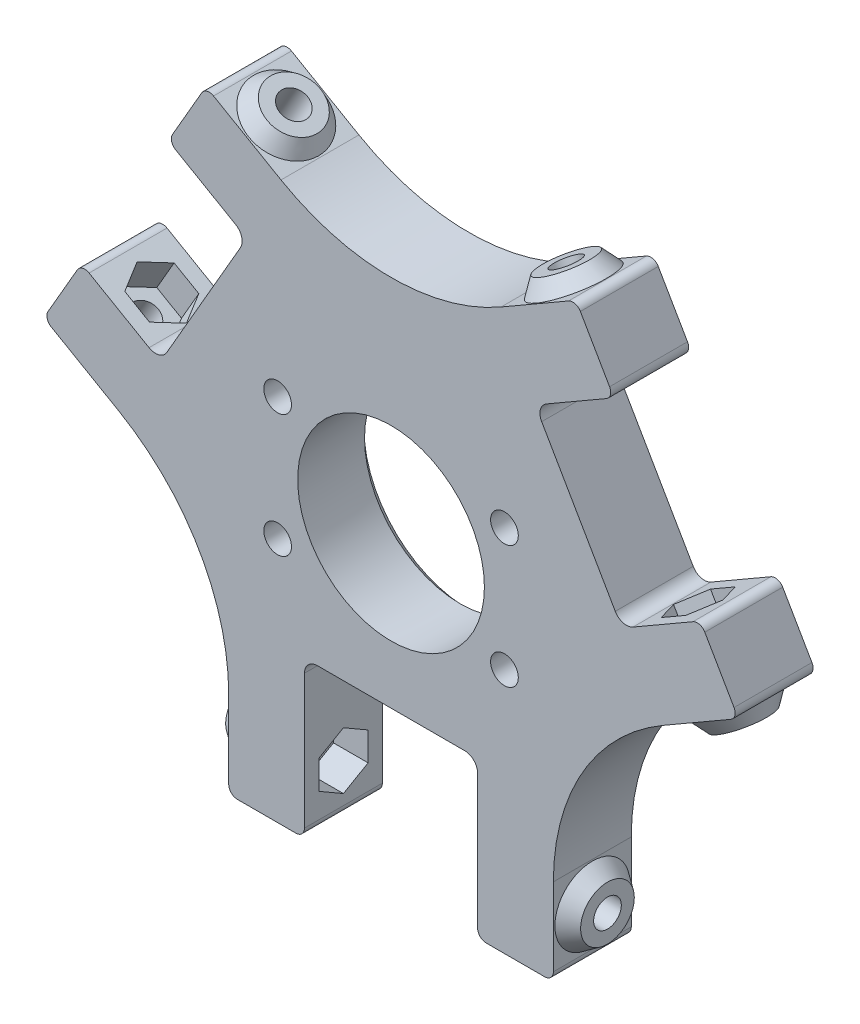
from build123d import *

# Parameters (mm, degrees)
BOSS_EXTRUDE1_DEPTH     = 9
SKETCH4_R               = 3.1
BOSS_EXTRUDE3_DEPTH     = 1.75
BOSS_EXTRUDE3_DRAFT     = 35
SKETCH7_R               = 1.600000259
CUT_EXTRUDE4_DEPTH      = 15
CUT_EXTRUDE5_DEPTH      = 7
MIRROR1_START           = -14
MIRROR1_DEPTH           = 4
MIRROR1_START_2         = -18.75
MIRROR1_2_OUTLINE_R     = 1.600000259
MIRROR1_2_DEPTH         = 4.75
CIRPATTERN1_START       = -14
CIRPATTERN1_DEPTH       = 28
CIRPATTERN1_START_2     = -18.75
CIRPATTERN1_2_OUTLINE_R = 1.600000259
CIRPATTERN1_2_DEPTH     = 37.5
CIRPATTERN1_START_3     = -20.405762011
CIRPATTERN1_3_OUTLINE_R = 1.600000259
CIRPATTERN1_3_DEPTH     = 1.655762011
CIRPATTERN1_4_DEPTH     = 28
CIRPATTERN1_5_OUTLINE_R = 1.600000259
CIRPATTERN1_5_DEPTH     = 37.5
CIRPATTERN1_START_4     = 18.75
CIRPATTERN1_6_OUTLINE_R = 1.600000259
CIRPATTERN1_6_DEPTH     = 1.616403084
SKETCH8_R               = 11.1
CUT_EXTRUDE6_DEPTH      = 55.051282913
CUT_EXTRUDE6_TAPER      = 2
SKETCH9_R               = 1.6
CUT_EXTRUDE8_DEPTH      = 55.051282913
CHAMFER1_SIZE           = 1.036815955
CHAMFER1_SIZE_2         = 1


with BuildPart() as part:
    # Sketch3 → Boss-Extrude1 (new body)
    with BuildSketch(Plane.XY):
        with BuildLine():
            Line((-18.75, -34.5), (-18.75, -25.5))
            ThreePointArc((-18.75, -25.5), (-22.155271914, -12.791352203), (-31.458647797, -3.487976321))
            Line((-31.458647797, -3.487976321), (-39.252876431, 1.012023679))
            ThreePointArc((-39.252876431, 1.012023679), (-39.718802257, 1.619230038), (-39.618901834, 2.378049083))
            Line((-39.618901834, 2.378049083), (-36.243901834, 8.223720558))
            ThreePointArc((-36.243901834, 8.223720558), (-35.636695476, 8.689646385), (-34.877876431, 8.589745962))
            Line((-34.877876431, 8.589745962), (-27.9496732, 4.589745962))
            ThreePointArc((-27.9496732, 4.589745962), (-26.811444633, 4.439895328), (-25.900635095, 5.138784068))
            Line((-25.900635095, 5.138784068), (-17.400635095, 19.861215932))
            ThreePointArc((-17.400635095, 19.861215932), (-17.250784461, 20.9994445), (-17.9496732, 21.910254038))
            Line((-17.9496732, 21.910254038), (-24.877876431, 25.910254038))
            ThreePointArc((-24.877876431, 25.910254038), (-25.343802257, 26.517460397), (-25.243901834, 27.276279442))
            Line((-25.243901834, 27.276279442), (-21.868901834, 33.121950917))
            ThreePointArc((-21.868901834, 33.121950917), (-21.261695476, 33.587876743), (-20.502876431, 33.487976321))
            Line((-20.502876431, 33.487976321), (-12.708647797, 28.987976321))
            ThreePointArc((-12.708647797, 28.987976321), (0, 25.582704407), (12.708647797, 28.987976321))
            Line((12.708647797, 28.987976321), (20.502876431, 33.487976321))
            ThreePointArc((20.502876431, 33.487976321), (21.261695476, 33.587876743), (21.868901834, 33.121950917))
            Line((21.868901834, 33.121950917), (25.243901834, 27.276279442))
            ThreePointArc((25.243901834, 27.276279442), (25.343802257, 26.517460397), (24.877876431, 25.910254038))
            Line((24.877876431, 25.910254038), (17.9496732, 21.910254038))
            ThreePointArc((17.9496732, 21.910254038), (17.250784461, 20.9994445), (17.400635095, 19.861215932))
            Line((17.400635095, 19.861215932), (25.900635095, 5.138784068))
            ThreePointArc((25.900635095, 5.138784068), (26.811444633, 4.439895328), (27.9496732, 4.589745962))
            Line((27.9496732, 4.589745962), (34.877876431, 8.589745962))
            ThreePointArc((34.877876431, 8.589745962), (35.636695476, 8.689646385), (36.243901834, 8.223720558))
            Line((36.243901834, 8.223720558), (39.618901834, 2.378049083))
            ThreePointArc((39.618901834, 2.378049083), (39.718802257, 1.619230038), (39.252876431, 1.012023679))
            Line((39.252876431, 1.012023679), (31.458647797, -3.487976321))
            ThreePointArc((31.458647797, -3.487976321), (22.155271914, -12.791352203), (18.75, -25.5))
            Line((18.75, -25.5), (18.75, -34.5))
            ThreePointArc((18.75, -34.5), (18.457106781, -35.207106781), (17.75, -35.5))
            Line((17.75, -35.5), (11, -35.5))
            ThreePointArc((11, -35.5), (10.292893219, -35.207106781), (10, -34.5))
            Line((10, -34.5), (10, -19))
            ThreePointArc((10, -19), (9.560660172, -17.939339828), (8.5, -17.5))
            Line((8.5, -17.5), (-8.5, -17.5))
            ThreePointArc((-8.5, -17.5), (-9.560660172, -17.939339828), (-10, -19))
            Line((-10, -19), (-10, -34.5))
            ThreePointArc((-10, -34.5), (-10.292893219, -35.207106781), (-11, -35.5))
            Line((-11, -35.5), (-17.75, -35.5))
            ThreePointArc((-17.75, -35.5), (-18.457106781, -35.207106781), (-18.75, -34.5))
        make_face()
    extrude(amount=BOSS_EXTRUDE1_DEPTH)


with BuildPart() as boss_extrude3_tool:
    # Sketch4 → Boss-Extrude3 (with draft: the straight prism first)
    with BuildSketch(Plane(origin=(20.5, 0, 0), x_dir=(0, 0, -1), z_dir=(1, 0, 0))):
        with Locations((-4.5, -30)):
            Circle(SKETCH4_R)
    extrude(amount=-BOSS_EXTRUDE3_DEPTH)
    # Boss-Extrude3: the draft: its side faces are tilted about the plane it starts from
    boss_extrude3_sides = [boss_extrude3_tool.faces().sort_by_distance(p)[0] for p in [
        (19.625, -30, 7.6),
    ]]
    draft(boss_extrude3_sides, Plane(origin=(20.5, 0, 0), x_dir=(0, 0, -1), z_dir=(1, 0, 0)), BOSS_EXTRUDE3_DRAFT)


with BuildPart() as part_1:
    add(part.part)

    # Boss-Extrude3: add boss_extrude3_tool
    add(boss_extrude3_tool.part)

    # Sketch7 → Cut-Extrude4 (cut)
    with BuildSketch(Plane(origin=(20.5, 0, 0), x_dir=(0, 0, -1), z_dir=(1, 0, 0))):
        with Locations((-4.5, -30)):
            Circle(SKETCH7_R)
    extrude(amount=-CUT_EXTRUDE4_DEPTH, mode=Mode.SUBTRACT)

    # Sketch5 → Cut-Extrude5 (cut)
    with BuildSketch(Plane(origin=(14, 0, 0), x_dir=(0, 0, -1), z_dir=(1, 0, 0))):
        Polygon((-7.349999794, -28.354551852), (-7.349999794, -31.645448148), (-4.5, -33.290896297), (-1.650000206, -31.645448148), (-1.650000206, -28.354551852), (-4.5, -26.709103703), align=None)
    extrude(amount=-CUT_EXTRUDE5_DEPTH, mode=Mode.SUBTRACT)

    # Mirror1: read off the stored shape, not the designer's step
    # Mirror1 outline → Mirror1 (cut)
    with BuildSketch(Plane.YZ.offset(MIRROR1_START)):
        Polygon((-26.709103703, 4.5), (-28.354551852, 7.349999794), (-31.645448148, 7.349999794), (-33.290896297, 4.5), (-31.645448148, 1.650000206), (-28.354551852, 1.650000206), align=None)
    extrude(amount=MIRROR1_DEPTH, mode=Mode.SUBTRACT)

    # Mirror1 2 outline → Mirror1 2 (cut)
    with BuildSketch(Plane.YZ.offset(MIRROR1_START_2)):
        with Locations((-30, 4.5)):
            Circle(MIRROR1_2_OUTLINE_R)
    extrude(amount=MIRROR1_2_DEPTH, mode=Mode.SUBTRACT)

    # Mirror1 3 outline → Mirror1 3 (revolve)
    with BuildSketch(Plane(origin=(0, -30, 4.5), x_dir=(0, 1, 0), z_dir=(0, 0, -1))):
        Polygon((1.600000259, -18.75), (1.600000259, -20.5), (3.1, -20.5), (4.325363192, -18.75), align=None)
    revolve(axis=Axis((0, -30, 4.5), (1, 0, 0)))

    # CirPattern1: read off the stored shape, not the designer's step
    # CirPattern1 outline → CirPattern1 (cut)
    with BuildSketch(Plane(origin=(0, 0, 0), x_dir=(0.8660254037844362, 0.5000000000000042, 0), z_dir=(0.5000000000000042, -0.8660254037844363, 0)).offset(CIRPATTERN1_START)):
        Polygon((26.709103703, 4.5), (28.354551852, 1.650000206), (31.645448148, 1.650000206), (33.290896297, 4.5), (31.645448148, 7.349999794), (28.354551852, 7.349999794), align=None)
    extrude(amount=CIRPATTERN1_DEPTH, mode=Mode.SUBTRACT)

    # CirPattern1 2 outline → CirPattern1 2 (cut)
    with BuildSketch(Plane(origin=(0, 0, 0), x_dir=(0.8660254037844362, 0.5000000000000042, 0), z_dir=(0.5000000000000042, -0.8660254037844363, 0)).offset(CIRPATTERN1_START_2)):
        with Locations((30, 4.5)):
            Circle(CIRPATTERN1_2_OUTLINE_R)
    extrude(amount=CIRPATTERN1_2_DEPTH, mode=Mode.SUBTRACT)

    # CirPattern1 3 outline → CirPattern1 3 (add)
    with BuildSketch(Plane(origin=(0, 0, 0), x_dir=(0.8660254037844362, 0.5000000000000042, 0), z_dir=(0.5000000000000042, -0.8660254037844363, 0)).offset(CIRPATTERN1_START_3)):
        Polygon((26.709103703, 4.5), (28.354551852, 1.650000206), (31.645448148, 1.650000206), (33.290896297, 4.5), (31.645448148, 7.349999794), (28.354551852, 7.349999794), align=None)
        with Locations((30, 4.5)):
            Circle(CIRPATTERN1_3_OUTLINE_R, mode=Mode.SUBTRACT)
    extrude(amount=CIRPATTERN1_3_DEPTH)

    # CirPattern1 4 outline → CirPattern1 4 (cut)
    with BuildSketch(Plane(origin=(0, 0, 0), x_dir=(0.8660254037844431, -0.4999999999999921, 0), z_dir=(0.4999999999999921, 0.8660254037844433, 0)).offset(CIRPATTERN1_START)):
        Polygon((-26.709103703, -4.5), (-28.354551852, -1.650000206), (-31.645448148, -1.650000206), (-33.290896297, -4.5), (-31.645448148, -7.349999794), (-28.354551852, -7.349999794), align=None)
    extrude(amount=CIRPATTERN1_4_DEPTH, mode=Mode.SUBTRACT)

    # CirPattern1 5 outline → CirPattern1 5 (cut)
    with BuildSketch(Plane(origin=(0, 0, 0), x_dir=(0.8660254037844431, -0.4999999999999921, 0), z_dir=(0.4999999999999921, 0.8660254037844433, 0)).offset(CIRPATTERN1_START_2)):
        with Locations((-30, -4.5)):
            Circle(CIRPATTERN1_5_OUTLINE_R)
    extrude(amount=CIRPATTERN1_5_DEPTH, mode=Mode.SUBTRACT)

    # CirPattern1 6 outline → CirPattern1 6 (add)
    with BuildSketch(Plane(origin=(0, 0, 0), x_dir=(0.8660254037844431, -0.4999999999999921, 0), z_dir=(0.4999999999999921, 0.8660254037844433, 0)).offset(CIRPATTERN1_START_4)):
        Polygon((-26.709103703, -4.5), (-28.354551852, -1.650000206), (-31.645448148, -1.650000206), (-33.290896297, -4.5), (-31.645448148, -7.349999794), (-28.354551852, -7.349999794), align=None)
        with Locations((-30, -4.5)):
            Circle(CIRPATTERN1_6_OUTLINE_R, mode=Mode.SUBTRACT)
    extrude(amount=CIRPATTERN1_6_DEPTH)

    # CirPattern1 7 outline → CirPattern1 7 (revolve)
    with BuildSketch(Plane(origin=(-25.980762114, 15, 4.5), x_dir=(0.8660254037844431, -0.4999999999999921, 0), z_dir=(0, 0, 1))):
        Polygon((3.1, 20.5), (1.600000259, 20.5), (1.600000259, 18.75), (4.325363192, 18.75), align=None)
        Polygon((1.600000259, -18.75), (1.600000259, -20.5), (3.1, -20.5), (4.325363192, -18.75), align=None)
    revolve(axis=Axis((-25.980762114, 15, 4.5), (0.4999999999999921, 0.8660254037844431, 0)))

    # CirPattern1 8 outline → CirPattern1 8 (revolve)
    with BuildSketch(Plane(origin=(25.980762114, 15, 4.5), x_dir=(0.8660254037844362, 0.5000000000000042, 0), z_dir=(0, 0, -1))):
        Polygon((3.1, 20.5), (1.600000259, 20.5), (1.600000259, 18.75), (4.325363192, 18.75), align=None)
        Polygon((1.600000259, -18.75), (1.600000259, -20.5), (3.1, -20.5), (4.325363192, -18.75), align=None)
    revolve(axis=Axis((25.980762114, 15, 4.5), (0.5000000000000042, -0.8660254037844362, 0)))

    # CirPattern1 9 outline → CirPattern1 9 (revolve, cut)
    with BuildSketch(Plane(origin=(-25.980762114, 15, 4.5), x_dir=(0.8660254037844431, -0.4999999999999921, 0), z_dir=(0, 0, 1))):
        Polygon((3.290896297, 20.366403084), (3.193545568, 20.366403084), (3.290896297, 20.227371834), align=None)
    revolve(axis=Axis((-25.980762114, 15, 4.5), (0.4999999999999921, 0.8660254037844431, 0)), mode=Mode.SUBTRACT)

    # CirPattern1 10 outline → CirPattern1 10 (revolve, cut)
    with BuildSketch(Plane(origin=(25.980762114, 15, 4.5), x_dir=(0.8660254037844362, 0.5000000000000042, 0), z_dir=(0, 0, -1))):
        Polygon((3.290896297, -20.227371834), (3.16598615, -20.405762011), (3.290896297, -20.405762011), align=None)
    revolve(axis=Axis((25.980762114, 15, 4.5), (0.5000000000000042, -0.8660254037844362, 0)), mode=Mode.SUBTRACT)

    # Sketch8 → Cut-Extrude6 (cut, through all)
    with BuildSketch(Plane.XY):
        Circle(SKETCH8_R)
    extrude(amount=CUT_EXTRUDE6_DEPTH, taper=CUT_EXTRUDE6_TAPER, mode=Mode.SUBTRACT)

    # Sketch9 → Cut-Extrude8 (cut, through all)
    with BuildSketch(Plane.XY):
        with Locations((13.1, -7.1)):
            Circle(SKETCH9_R)
        with Locations((13.1, 7.1)):
            Circle(SKETCH9_R)
        with Locations((-13.1, 7.1)):
            Circle(SKETCH9_R)
        with Locations((-13.1, -7.1)):
            Circle(SKETCH9_R)
    extrude(amount=CUT_EXTRUDE8_DEPTH, mode=Mode.SUBTRACT)

    # Chamfer1
    # the kernel refuses this chamfer: 1.036815955, 1 mm, written as the material it takes off along each edge
    with BuildSketch(Plane(origin=(0, 0, 0), x_dir=(1, 0, 0), z_dir=(0, 1, 0))) as chamfer1_piece_1:
        Polygon((11.1 + CHAMFER1_SIZE, 0), (11.1 - CHAMFER1_SIZE_2 * 0.0348994967025, -CHAMFER1_SIZE_2 * 0.999390827019), (11.1, 0), align=None)
    revolve(axis=Axis((0, 0, 0), (0, 0, -1)), mode=Mode.SUBTRACT)


solid = part_1.part
